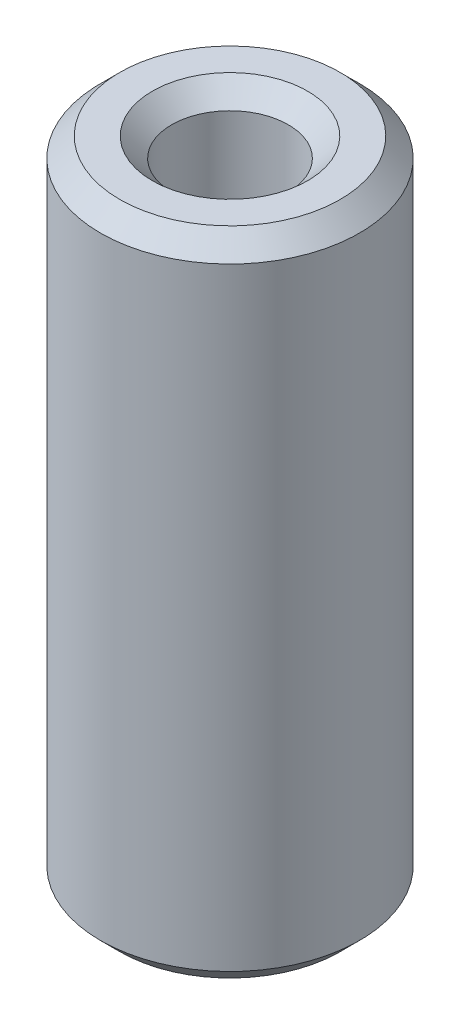
from build123d import *

# Parameters (mm, degrees)
SKETCH1_R           = 25
BOSS_EXTRUDE1_DEPTH = 125.725835537
SKETCH2_R           = 11.247140366
CUT_EXTRUDE1_DEPTH  = 131.602395543
CHAMFER1_SIZE       = 3.739293031


with BuildPart() as part:
    # Sketch1 → Boss-Extrude1 (new body)
    with BuildSketch(Plane(origin=(0, 0, 0), x_dir=(1, 0, 0), z_dir=(0, 1, 0))):
        Circle(SKETCH1_R)
    extrude(amount=BOSS_EXTRUDE1_DEPTH)

    # Sketch2 → Cut-Extrude1 (cut, through all)
    with BuildSketch(Plane(origin=(0, 0, 0), x_dir=(1, 0, 0), z_dir=(0, 1, 0))):
        Circle(SKETCH2_R)
    extrude(amount=CUT_EXTRUDE1_DEPTH, mode=Mode.SUBTRACT)

    # Chamfer1
    chamfer1_edges = [part.edges().sort_by_distance(p)[0] for p in [
        (-11.247140366, 125.725835537, 0),
        (-11.247140366, 0, 0),
        (-25, 0, 0),
        (-25, 125.725835537, 0),
    ]]
    chamfer(chamfer1_edges, length=CHAMFER1_SIZE)


solid = part.part
